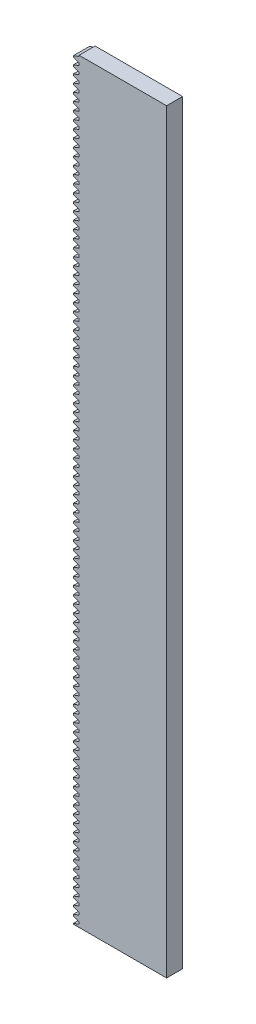
from build123d import *

# Parameters (mm, degrees)
BOSS_EXTRUDE1_DEPTH = 3.175


with BuildPart() as part:
    # Sketch1 → Boss-Extrude1 (new body)
    with BuildSketch(Plane.XY):
        Polygon((-9.5, -73.593966677), (-8.375, -74.00343319), (-8.375, -74.44786856), (-9.5, -74.857335073), (-9.5, -75), (9, -75), (9, 75), (-8.375, 75), (-8.375, 74.777782315), (-9.5, 74.368315802), (-9.5, 74.060887873), (-8.375, 73.65142136), (-8.375, 73.20698599), (-9.5, 72.797519477), (-9.5, 72.490091548), (-8.375, 72.080625035), (-8.375, 71.636189665), (-9.5, 71.226723152), (-9.5, 70.919295223), (-8.375, 70.50982871), (-8.375, 70.06539334), (-9.5, 69.655926827), (-9.5, 69.348498898), (-8.375, 68.939032385), (-8.375, 68.494597015), (-9.5, 68.085130502), (-9.5, 67.777702573), (-8.375, 67.36823606), (-8.375, 66.92380069), (-9.5, 66.514334177), (-9.5, 66.206906248), (-8.375, 65.797439735), (-8.375, 65.353004365), (-9.5, 64.943537852), (-9.5, 64.636109923), (-8.375, 64.22664341), (-8.375, 63.78220804), (-9.5, 63.372741527), (-9.5, 63.065313598), (-8.375, 62.655847085), (-8.375, 62.211411715), (-9.5, 61.801945202), (-9.5, 61.494517273), (-8.375, 61.08505076), (-8.375, 60.64061539), (-9.5, 60.231148877), (-9.5, 59.923720948), (-8.375, 59.514254435), (-8.375, 59.069819065), (-9.5, 58.660352552), (-9.5, 58.352924623), (-8.375, 57.94345811), (-8.375, 57.49902274), (-9.5, 57.089556227), (-9.5, 56.782128298), (-8.375, 56.372661785), (-8.375, 55.928226415), (-9.5, 55.518759902), (-9.5, 55.211331973), (-8.375, 54.80186546), (-8.375, 54.35743009), (-9.5, 53.947963577), (-9.5, 53.640535648), (-8.375, 53.231069135), (-8.375, 52.786633765), (-9.5, 52.377167252), (-9.5, 52.069739323), (-8.375, 51.66027281), (-8.375, 51.21583744), (-9.5, 50.806370927), (-9.5, 50.498942998), (-8.375, 50.089476485), (-8.375, 49.645041115), (-9.5, 49.235574602), (-9.5, 48.928146673), (-8.375, 48.51868016), (-8.375, 48.07424479), (-9.5, 47.664778277), (-9.5, 47.357350348), (-8.375, 46.947883835), (-8.375, 46.503448465), (-9.5, 46.093981952), (-9.5, 45.786554023), (-8.375, 45.37708751), (-8.375, 44.93265214), (-9.5, 44.523185627), (-9.5, 44.215757698), (-8.375, 43.806291185), (-8.375, 43.361855815), (-9.5, 42.952389302), (-9.5, 42.644961373), (-8.375, 42.23549486), (-8.375, 41.79105949), (-9.5, 41.381592977), (-9.5, 41.074165048), (-8.375, 40.664698535), (-8.375, 40.220263165), (-9.5, 39.810796652), (-9.5, 39.503368723), (-8.375, 39.09390221), (-8.375, 38.64946684), (-9.5, 38.240000327), (-9.5, 37.932572398), (-8.375, 37.523105885), (-8.375, 37.078670515), (-9.5, 36.669204002), (-9.5, 36.361776073), (-8.375, 35.95230956), (-8.375, 35.50787419), (-9.5, 35.098407677), (-9.5, 34.790979748), (-8.375, 34.381513235), (-8.375, 33.937077865), (-9.5, 33.527611352), (-9.5, 33.220183423), (-8.375, 32.81071691), (-8.375, 32.36628154), (-9.5, 31.956815027), (-9.5, 31.649387098), (-8.375, 31.239920585), (-8.375, 30.795485215), (-9.5, 30.386018702), (-9.5, 30.078590773), (-8.375, 29.66912426), (-8.375, 29.22468889), (-9.5, 28.815222377), (-9.5, 28.507794448), (-8.375, 28.098327935), (-8.375, 27.653892565), (-9.5, 27.244426052), (-9.5, 26.936998123), (-8.375, 26.52753161), (-8.375, 26.08309624), (-9.5, 25.673629727), (-9.5, 25.366201798), (-8.375, 24.956735285), (-8.375, 24.512299915), (-9.5, 24.102833402), (-9.5, 23.795405473), (-8.375, 23.38593896), (-8.375, 22.94150359), (-9.5, 22.532037077), (-9.5, 22.224609148), (-8.375, 21.815142635), (-8.375, 21.370707265), (-9.5, 20.961240752), (-9.5, 20.653812823), (-8.375, 20.24434631), (-8.375, 19.79991094), (-9.5, 19.390444427), (-9.5, 19.083016498), (-8.375, 18.673549985), (-8.375, 18.229114615), (-9.5, 17.819648102), (-9.5, 17.512220173), (-8.375, 17.10275366), (-8.375, 16.65831829), (-9.5, 16.248851777), (-9.5, 15.941423848), (-8.375, 15.531957335), (-8.375, 15.087521965), (-9.5, 14.678055452), (-9.5, 14.370627523), (-8.375, 13.96116101), (-8.375, 13.51672564), (-9.5, 13.107259127), (-9.5, 12.799831198), (-8.375, 12.390364685), (-8.375, 11.945929315), (-9.5, 11.536462802), (-9.5, 11.229034873), (-8.375, 10.81956836), (-8.375, 10.37513299), (-9.5, 9.965666477), (-9.5, 9.658238548), (-8.375, 9.248772035), (-8.375, 8.804336665), (-9.5, 8.394870152), (-9.5, 8.087442223), (-8.375, 7.67797571), (-8.375, 7.23354034), (-9.5, 6.824073827), (-9.5, 6.516645898), (-8.375, 6.107179385), (-8.375, 5.662744015), (-9.5, 5.253277502), (-9.5, 4.945849573), (-8.375, 4.53638306), (-8.375, 4.09194769), (-9.5, 3.682481177), (-9.5, 3.375053248), (-8.375, 2.965586735), (-8.375, 2.521151365), (-9.5, 2.111684852), (-9.5, 1.804256923), (-8.375, 1.39479041), (-8.375, 0.95035504), (-9.5, 0.540888527), (-9.5, 0.233460598), (-8.375, -0.176005915), (-8.375, -0.620441285), (-9.5, -1.029907798), (-9.5, -1.337335727), (-8.375, -1.74680224), (-8.375, -2.19123761), (-9.5, -2.600704123), (-9.5, -2.908132052), (-8.375, -3.317598565), (-8.375, -3.762033935), (-9.5, -4.171500448), (-9.5, -4.478928377), (-8.375, -4.88839489), (-8.375, -5.33283026), (-9.5, -5.742296773), (-9.5, -6.049724702), (-8.375, -6.459191215), (-8.375, -6.903626585), (-9.5, -7.313093098), (-9.5, -7.620521027), (-8.375, -8.02998754), (-8.375, -8.47442291), (-9.5, -8.883889423), (-9.5, -9.191317352), (-8.375, -9.600783865), (-8.375, -10.045219235), (-9.5, -10.454685748), (-9.5, -10.762113677), (-8.375, -11.17158019), (-8.375, -11.61601556), (-9.5, -12.025482073), (-9.5, -12.332910002), (-8.375, -12.742376515), (-8.375, -13.186811885), (-9.5, -13.596278398), (-9.5, -13.903706327), (-8.375, -14.31317284), (-8.375, -14.75760821), (-9.5, -15.167074723), (-9.5, -15.474502652), (-8.375, -15.883969165), (-8.375, -16.328404535), (-9.5, -16.737871048), (-9.5, -17.045298977), (-8.375, -17.45476549), (-8.375, -17.89920086), (-9.5, -18.308667373), (-9.5, -18.616095302), (-8.375, -19.025561815), (-8.375, -19.469997185), (-9.5, -19.879463698), (-9.5, -20.186891627), (-8.375, -20.59635814), (-8.375, -21.04079351), (-9.5, -21.450260023), (-9.5, -21.757687952), (-8.375, -22.167154465), (-8.375, -22.611589835), (-9.5, -23.021056348), (-9.5, -23.328484277), (-8.375, -23.73795079), (-8.375, -24.18238616), (-9.5, -24.591852673), (-9.5, -24.899280602), (-8.375, -25.308747115), (-8.375, -25.753182485), (-9.5, -26.162648998), (-9.5, -26.470076927), (-8.375, -26.87954344), (-8.375, -27.32397881), (-9.5, -27.733445323), (-9.5, -28.040873252), (-8.375, -28.450339765), (-8.375, -28.894775135), (-9.5, -29.304241648), (-9.5, -29.611669577), (-8.375, -30.02113609), (-8.375, -30.46557146), (-9.5, -30.875037973), (-9.5, -31.182465902), (-8.375, -31.591932415), (-8.375, -32.036367785), (-9.5, -32.445834298), (-9.5, -32.753262227), (-8.375, -33.16272874), (-8.375, -33.60716411), (-9.5, -34.016630623), (-9.5, -34.324058552), (-8.375, -34.733525065), (-8.375, -35.177960435), (-9.5, -35.587426948), (-9.5, -35.894854877), (-8.375, -36.30432139), (-8.375, -36.74875676), (-9.5, -37.158223273), (-9.5, -37.465651202), (-8.375, -37.875117715), (-8.375, -38.319553085), (-9.5, -38.729019598), (-9.5, -39.036447527), (-8.375, -39.44591404), (-8.375, -39.89034941), (-9.5, -40.299815923), (-9.5, -40.607243852), (-8.375, -41.016710365), (-8.375, -41.461145735), (-9.5, -41.870612248), (-9.5, -42.178040177), (-8.375, -42.58750669), (-8.375, -43.03194206), (-9.5, -43.441408573), (-9.5, -43.748836502), (-8.375, -44.158303015), (-8.375, -44.602738385), (-9.5, -45.012204898), (-9.5, -45.319632827), (-8.375, -45.72909934), (-8.375, -46.17353471), (-9.5, -46.583001223), (-9.5, -46.890429152), (-8.375, -47.299895665), (-8.375, -47.744331035), (-9.5, -48.153797548), (-9.5, -48.461225477), (-8.375, -48.87069199), (-8.375, -49.31512736), (-9.5, -49.724593873), (-9.5, -50.032021802), (-8.375, -50.441488315), (-8.375, -50.885923685), (-9.5, -51.295390198), (-9.5, -51.602818127), (-8.375, -52.01228464), (-8.375, -52.45672001), (-9.5, -52.866186523), (-9.5, -53.173614452), (-8.375, -53.583080965), (-8.375, -54.027516335), (-9.5, -54.436982848), (-9.5, -54.744410777), (-8.375, -55.15387729), (-8.375, -55.59831266), (-9.5, -56.007779173), (-9.5, -56.315207102), (-8.375, -56.724673615), (-8.375, -57.169108985), (-9.5, -57.578575498), (-9.5, -57.886003427), (-8.375, -58.29546994), (-8.375, -58.73990531), (-9.5, -59.149371823), (-9.5, -59.456799752), (-8.375, -59.866266265), (-8.375, -60.310701635), (-9.5, -60.720168148), (-9.5, -61.027596077), (-8.375, -61.43706259), (-8.375, -61.88149796), (-9.5, -62.290964473), (-9.5, -62.598392402), (-8.375, -63.007858915), (-8.375, -63.452294285), (-9.5, -63.861760798), (-9.5, -64.169188727), (-8.375, -64.57865524), (-8.375, -65.02309061), (-9.5, -65.432557123), (-9.5, -65.739985052), (-8.375, -66.149451565), (-8.375, -66.593886935), (-9.5, -67.003353448), (-9.5, -67.310781377), (-8.375, -67.72024789), (-8.375, -68.16468326), (-9.5, -68.574149773), (-9.5, -68.881577702), (-8.375, -69.291044215), (-8.375, -69.735479585), (-9.5, -70.144946098), (-9.5, -70.452374027), (-8.375, -70.86184054), (-8.375, -71.30627591), (-9.5, -71.715742423), (-9.5, -72.023170352), (-8.375, -72.432636865), (-8.375, -72.877072235), (-9.5, -73.286538748), align=None)
    extrude(amount=BOSS_EXTRUDE1_DEPTH)


solid = part.part
